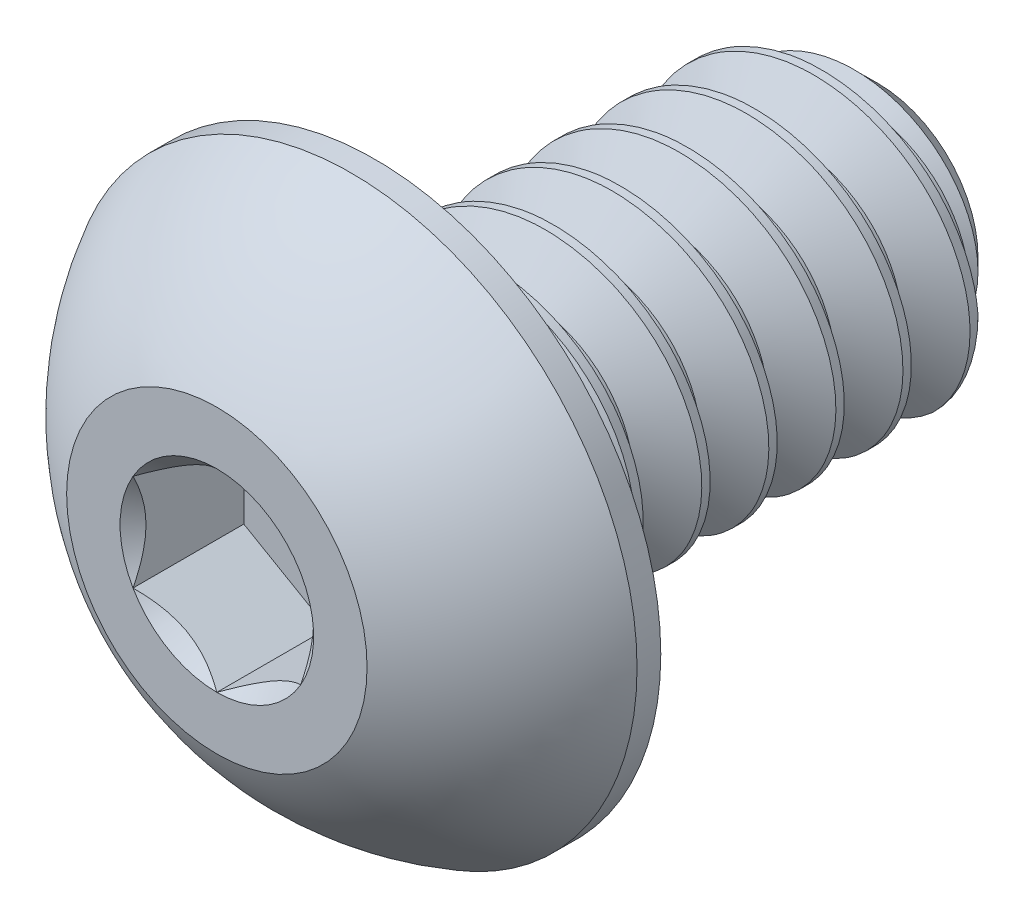
from build123d import *

# Parameters (mm, degrees)
SKETCH1_W          = 4.7625
SKETCH1_H          = 1.4224
CHAMFER1_SIZE      = 0.47625
CUT_SWEEP1_PITCH   = 0.635
CUT_EXTRUDE2_DEPTH = 1.04902


with BuildPart() as part:
    # Sketch1 → Revolve1 (revolve)
    with BuildSketch(Plane(origin=(0, 0, 0), x_dir=(0, 0, -1), z_dir=(1, 0, 0))):
        with Locations((3.87985, 0.7112)):
            Rectangle(SKETCH1_W, SKETCH1_H)
    revolve(axis=Axis((0, 0, -6.2611), (0, 0, 1)))

    # Chamfer1
    chamfer1_edges = [part.edges().sort_by_distance(p)[0] for p in [
        (0, -1.4224, -6.2611),
    ]]
    chamfer(chamfer1_edges, length=CHAMFER1_SIZE)

    # Cut-Sweep1: the profile of Sketch2 profile screwed along a right-hand helix of 8.5 turns, 6 arcs to a turn; built about Z, then put on its axis
    cut_sweep1_z = Axis((0, 0, 0), (0, 0, 1))
    cut_sweep1_corners = [(1.4227, 0, 0.000173205), (1.4227, 0, -0.555798205), (1.009955401, 0, -0.3175), (1.009955401, 0, -0.238125)]
    with BuildLine(mode=Mode.PRIVATE) as cut_sweep1_profile:
        Line(cut_sweep1_corners[0], cut_sweep1_corners[1])
        Line(cut_sweep1_corners[1], cut_sweep1_corners[2])
        Line(cut_sweep1_corners[2], cut_sweep1_corners[3])
        Line(cut_sweep1_corners[3], cut_sweep1_corners[0])
    cut_sweep1_cap = Face(cut_sweep1_profile.wire())
    cut_sweep1_turn_angles = [0, 30, 60, 90, 120, 150, 180, 210, 240, 270, 300, 330, 360]
    cut_sweep1_turn_weights = [1, 0.8660254037844387, 1, 0.8660254037844387, 1, 0.8660254037844387, 1, 0.8660254037844387, 1, 0.8660254037844387, 1, 0.8660254037844387, 1]
    cut_sweep1_turn_rails = [Edge.make_bspline([Vector(p[0], p[1], 0).rotate(cut_sweep1_z, cut_sweep1_turn_angles[k]) / cut_sweep1_turn_weights[k] + Vector(0, 0, p[2] + CUT_SWEEP1_PITCH * cut_sweep1_turn_angles[k] / 360) for k in range(13)], [0, 0, 0, 1, 1, 2, 2, 3, 3, 4, 4, 5, 5, 6, 6, 6], 2, cut_sweep1_turn_weights) for p in cut_sweep1_corners]
    cut_sweep1_turn_sides = [Face.make_surface_from_curves(cut_sweep1_turn_rails[p[0]], cut_sweep1_turn_rails[p[1]]) for p in [(0, 1), (1, 2), (2, 3), (3, 0)]]
    cut_sweep1_last_angles = [2880, 2910, 2940, 2970, 3000, 3030, 3060]
    cut_sweep1_last_weights = [1, 0.8660254037844387, 1, 0.8660254037844387, 1, 0.8660254037844426, 1]
    cut_sweep1_last_rails = [Edge.make_bspline([Vector(p[0], p[1], 0).rotate(cut_sweep1_z, cut_sweep1_last_angles[k]) / cut_sweep1_last_weights[k] + Vector(0, 0, p[2] + CUT_SWEEP1_PITCH * cut_sweep1_last_angles[k] / 360) for k in range(7)], [0, 0, 0, 1, 1, 2, 2, 3, 3, 3], 2, cut_sweep1_last_weights) for p in cut_sweep1_corners]
    cut_sweep1_last_sides = [Face.make_surface_from_curves(cut_sweep1_last_rails[p[0]], cut_sweep1_last_rails[p[1]]) for p in [(0, 1), (1, 2), (2, 3), (3, 0)]]
    cut_sweep1 = Plane(origin=(0, 0, -6.2611), x_dir=(0, 1, 0), z_dir=(0, 0, 1)) * Solid(Shell([*[p.moved(Location((0, 0, CUT_SWEEP1_PITCH * i))) for i in range(8) for p in cut_sweep1_turn_sides], *cut_sweep1_last_sides, cut_sweep1_cap, cut_sweep1_cap.rotate(cut_sweep1_z, 3060).moved(Location((0, 0, CUT_SWEEP1_PITCH * 3060 / 360)))]))
    add(cut_sweep1, mode=Mode.SUBTRACT)

    # Sketch7 → Revolve2 (revolve)
    with BuildSketch(Plane(origin=(0, 0, 0), x_dir=(0, 0, -1), z_dir=(1, 0, 0)), mode=Mode.PRIVATE) as revolve2_sk:
        with BuildLine():
            Line((1.27381, 2.7051), (1.4986, 2.7051))
            Line((1.4986, 2.7051), (1.4986, 0))
            Line((1.4986, 0), (0, 0))
            Line((0, 0), (0, 1.4224))
            ThreePointArc((0, 1.4224), (0.540190256, 2.159794444), (1.27381, 2.7051))
        make_face()
    revolve(revolve2_sk.sketch.rotate(Axis((0, 0, 0), (0, 0, -1)), 189.336081704), axis=Axis((0, 0, 0), (0, 0, -1)))

    # Sketch5 → Cut-Extrude2 (cut)
    with BuildSketch(Plane.XY):
        Polygon((0.79375, -0.458271776), (0.79375, 0.458271776), (0, 0.916543552), (-0.79375, 0.458271776), (-0.79375, -0.458271776), (0, -0.916543552), align=None)
    extrude(amount=-CUT_EXTRUDE2_DEPTH, mode=Mode.SUBTRACT)

    # Cut-Extrude3 cone 1 section (through the dimple's axis) → Cut-Extrude3 (revolve, cut)
    with BuildSketch(Plane(origin=(0, 0, 0), x_dir=(0, -1, 0), z_dir=(1, 0, 0))):
        Polygon((0, 0), (0.916543552, 0), (0, 0.916543552), align=None)
    revolve(axis=Axis((0, 0, 0), (0, 0, -1)), mode=Mode.SUBTRACT)


solid = part.part
